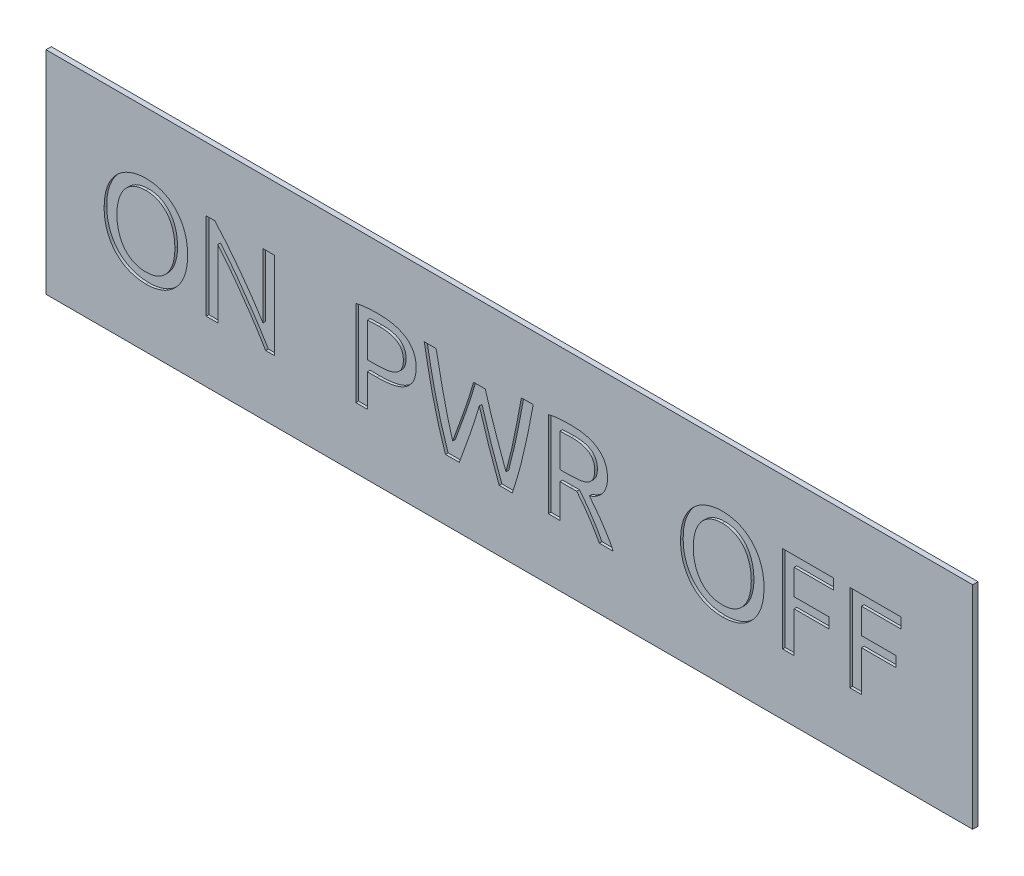
from build123d import *

# Parameters (mm, degrees)
SKETCH1_W           = 35
SKETCH1_H           = 8
BOSS_EXTRUDE1_DEPTH = 0.1
CUT_EXTRUDE6_DEPTH  = 0.1


with BuildPart() as part:
    # Sketch1 → Boss-Extrude1 (new, symmetric)
    with BuildSketch(Plane.XY):
        Rectangle(SKETCH1_W, SKETCH1_H)
    extrude(amount=BOSS_EXTRUDE1_DEPTH, both=True)

    # Sketch7 → Cut-Extrude6 (cut)
    # profile 1 of 8: a face of its own
    with BuildSketch(Plane.XY.offset(0.1)):
        with BuildLine():
            add(Edge.make_bspline(
                [(-15.304079424, -0.049022426), (-15.303711672, -0.01410778), (-15.302985198, 0.054864134), (-15.29643003, 0.156658327), (-15.287217749, 0.255347293), (-15.273406889, 0.350797572), (-15.255811776, 0.443118605), (-15.233718512, 0.53209643), (-15.208523544, 0.618094325), (-15.169588863, 0.727342223), (-15.112403668, 0.856063335), (-15.032348333, 0.999329375), (-14.940816758, 1.129143393), (-14.837914782, 1.245256657), (-14.724247477, 1.347395749), (-14.602258295, 1.437189266), (-14.470303031, 1.511892083), (-14.330663947, 1.573567585), (-14.183943903, 1.621037689), (-14.032471376, 1.656252472), (-13.876348377, 1.677212428), (-13.77088267, 1.679804671), (-13.717665979, 1.681112685)],
                knots=[0, 0, 0, 0, 0.792570647, 1.565678649, 2.315000585, 3.042323967, 3.754365743, 4.447760496, 5.122927003, 5.788006273, 7.079540449, 8.315548746, 9.508262372, 10.678590765, 11.830029448, 12.971618296, 14.110595966, 15.26540766, 16.431545614, 17.60623219, 18.792134379, 20, 20, 20, 20], degree=3))
            add(Edge.make_bspline(
                [(-13.717665979, 1.681112685), (-13.665131948, 1.679814278), (-13.561252407, 1.677246837), (-13.407627844, 1.656247239), (-13.258880962, 1.621043424), (-13.114699473, 1.573445498), (-12.977190484, 1.511687829), (-12.84678032, 1.437399735), (-12.72676556, 1.347106369), (-12.614393603, 1.245300238), (-12.513092566, 1.128671498), (-12.42131865, 0.999561111), (-12.342132263, 0.855996769), (-12.285510026, 0.727264243), (-12.246840269, 0.617971748), (-12.220561936, 0.532228818), (-12.198747207, 0.443099453), (-12.181070184, 0.35080288), (-12.167282058, 0.255345812), (-12.158063432, 0.15665874), (-12.15151001, 0.054864026), (-12.150783297, -0.014107817), (-12.150415424, -0.049022426)],
                knots=[0, 0, 0, 0, 1.200098081, 2.373045331, 3.535064534, 4.688987579, 5.837020001, 6.974362863, 8.110785483, 9.261997156, 10.43304313, 11.633514769, 12.875015323, 14.172847705, 14.842252987, 15.523309022, 16.221213965, 16.93788722, 17.669941481, 18.424137386, 19.202274073, 20, 20, 20, 20], degree=3))
            add(Edge.make_bspline(
                [(-12.150415424, -0.049022426), (-12.150783259, -0.083937046), (-12.151509897, -0.152908911), (-12.158063863, -0.254703464), (-12.167280515, -0.353391122), (-12.181075711, -0.44884609), (-12.198727263, -0.541150229), (-12.220685674, -0.630464535), (-12.246713725, -0.716510023), (-12.28542675, -0.825807155), (-12.342312855, -0.954188708), (-12.421299056, -1.097614082), (-12.513095467, -1.226717994), (-12.614400557, -1.343331195), (-12.726735631, -1.445203961), (-12.846983419, -1.535318533), (-12.976974287, -1.610572755), (-13.114743264, -1.672061573), (-13.258768783, -1.720006733), (-13.407736606, -1.754057995), (-13.561237602, -1.775353865), (-13.665126975, -1.777880012), (-13.717665979, -1.779157537)],
                knots=[0, 0, 0, 0, 0.797660173, 1.57573272, 2.329866459, 3.061860379, 3.778474561, 4.476321977, 5.162310661, 5.831660765, 7.124614354, 8.366012575, 9.566385262, 10.73733471, 11.888451492, 13.024780439, 14.164642593, 15.312580385, 16.466408316, 17.627150272, 18.800000839, 20, 20, 20, 20], degree=3))
            add(Edge.make_bspline(
                [(-13.717665979, -1.779157537), (-13.770887536, -1.777870322), (-13.876362887, -1.7753193), (-14.032364334, -1.754062329), (-14.184054472, -1.720002172), (-14.330620302, -1.672183055), (-14.470518474, -1.610779612), (-14.602055705, -1.535105274), (-14.724276941, -1.445493419), (-14.837908822, -1.343287957), (-14.940810342, -1.227188517), (-15.032381273, -1.09738751), (-15.112169427, -0.954233928), (-15.182127857, -0.798598417), (-15.236354892, -0.628908491), (-15.276149082, -0.446819992), (-15.299326783, -0.2519699), (-15.302464571, -0.117979924), (-15.304079424, -0.049022426)],
                knots=[0, 0, 0, 0, 0.966294476, 1.915018171, 2.853846361, 3.786758636, 4.710609883, 5.623854635, 6.537127584, 7.458280418, 8.39454505, 9.348717906, 10.33752657, 11.366969081, 12.442722914, 13.566707643, 14.747714126, 16, 16, 16, 16], degree=3))
        make_face()
        with BuildLine():
            add(Edge.make_bspline(
                [(-14.822269646, -0.049022426), (-14.821387208, -0.098562219), (-14.819659118, -0.195576732), (-14.805052594, -0.337418603), (-14.781197571, -0.472432256), (-14.747849135, -0.600176975), (-14.705671986, -0.720010176), (-14.654938118, -0.830617581), (-14.596541371, -0.932082478), (-14.530283044, -1.024260356), (-14.455066719, -1.106400134), (-14.371840851, -1.178257209), (-14.281637336, -1.241399906), (-14.183255778, -1.293487045), (-14.077601257, -1.334531561), (-13.96538423, -1.364107748), (-13.846857469, -1.381222183), (-13.765856413, -1.383689903), (-13.724509868, -1.384949537)],
                knots=[0, 0, 0, 0, 1.219915151, 2.388977954, 3.50768494, 4.593874435, 5.637052367, 6.63265979, 7.586765503, 8.516249197, 9.422985944, 10.323153062, 11.219383466, 12.129300506, 13.057951657, 14.005149726, 14.981739616, 16, 16, 16, 16], degree=3))
            add(Edge.make_bspline(
                [(-13.724509868, -1.384949537), (-13.683163178, -1.383695521), (-13.602387605, -1.381245655), (-13.484521851, -1.364185631), (-13.373435989, -1.334545719), (-13.26900933, -1.293319018), (-13.171456225, -1.241411673), (-13.081974667, -1.178223114), (-12.999333023, -1.106437115), (-12.924990147, -1.023819345), (-12.857824256, -0.932346613), (-12.799612306, -0.830575776), (-12.748806918, -0.720022169), (-12.706650263, -0.600173552), (-12.673295997, -0.472433219), (-12.649442615, -0.33741833), (-12.634835632, -0.195576805), (-12.633107606, -0.098562244), (-12.632225201, -0.049022426)],
                knots=[0, 0, 0, 0, 1.020887007, 1.994421647, 2.933173523, 3.853731272, 4.761024907, 5.65494637, 6.553188372, 7.458468617, 8.393664282, 9.35023113, 10.348406742, 11.394275573, 12.483266916, 13.604859629, 14.776938053, 16, 16, 16, 16], degree=3))
            add(Edge.make_bspline(
                [(-12.632225201, -0.049022426), (-12.633107579, 0.000517413), (-12.634835552, 0.097532015), (-12.649442916, 0.23937325), (-12.673294934, 0.374389174), (-12.706654045, 0.50212583), (-12.748793671, 0.621987372), (-12.799658479, 0.732495876), (-12.85757005, 0.834265368), (-12.925448285, 0.925176117), (-12.999090672, 1.008360735), (-13.081793277, 1.080235995), (-13.171681857, 1.142570119), (-13.26896405, 1.194693018), (-13.37356143, 1.235597338), (-13.484395785, 1.266375053), (-13.602405569, 1.283135718), (-13.68316926, 1.285628634), (-13.724509868, 1.286904685)],
                knots=[0, 0, 0, 0, 1.22322333, 2.395456409, 3.517197116, 4.606332151, 5.652338984, 6.650646306, 7.607339372, 8.538116746, 9.447696349, 10.346056874, 11.236877336, 12.144290688, 13.064969904, 14.00531519, 14.978978287, 16, 16, 16, 16], degree=3))
            add(Edge.make_bspline(
                [(-13.724509868, 1.286904685), (-13.765850491, 1.285623337), (-13.846839946, 1.283113078), (-13.965508564, 1.266296353), (-14.077476905, 1.235581944), (-14.183300903, 1.194861309), (-14.281412543, 1.142557052), (-14.372021402, 1.080271233), (-14.455309435, 1.008325619), (-14.529825389, 0.925617309), (-14.59679594, 0.834000034), (-14.654891978, 0.732537892), (-14.705685222, 0.621975318), (-14.747845356, 0.502129271), (-14.781198633, 0.374388207), (-14.805052293, 0.239373524), (-14.819659198, 0.097531941), (-14.821387235, 0.000517388), (-14.822269646, -0.049022426)],
                knots=[0, 0, 0, 0, 1.018396545, 1.995117023, 2.943890731, 3.87266606, 4.782704772, 5.675860912, 6.576148398, 7.487158225, 8.412220005, 9.3664533, 10.362193854, 11.405511279, 12.491846017, 13.610702595, 14.779921723, 16, 16, 16, 16], degree=3))
        make_face(mode=Mode.SUBTRACT)
    # profile 2 of 8: a face of its own
    with BuildSketch(Plane.XY.offset(0.1)):
        with BuildLine():
            add(Edge.make_bspline(
                [(-9.202752479, -1.691555759), (-9.220743134, -1.661423793), (-9.257887969, -1.59921111), (-9.315875484, -1.503506888), (-9.37848805, -1.403018369), (-9.467074747, -1.259314965), (-9.585525569, -1.072204335), (-9.737331345, -0.842731351), (-9.89647982, -0.606833356), (-10.062300449, -0.369424768), (-10.227653984, -0.132419499), (-10.395179641, 0.095493939), (-10.558652602, 0.313403785), (-10.69299547, 0.486123275), (-10.796647727, 0.616834885), (-10.87037647, 0.70779293), (-10.941439228, 0.792778027), (-10.988681112, 0.846699004), (-11.011592312, 0.872849407)],
                knots=[0, 0, 0, 0, 0.536211493, 1.107101878, 1.709725042, 2.345231406, 3.686461233, 5.09309405, 6.549041612, 8.034224013, 9.51768749, 10.964334184, 12.35580431, 13.679839341, 14.307497034, 14.904682337, 15.468796748, 16, 16, 16, 16], degree=3))
            Line((-11.011592312, 0.872849407), (-11.011592312, -1.691555759))
            Line((-11.011592312, -1.691555759), (-11.449601201, -1.691555759))
            Line((-11.449601201, -1.691555759), (-11.449601201, 1.593510907))
            Line((-11.449601201, 1.593510907), (-11.125200868, 1.593510907))
            add(Edge.make_bspline(
                [(-11.125200868, 1.593510907), (-11.087100471, 1.552656464), (-11.008643807, 1.468528644), (-10.892103474, 1.334603692), (-10.770875155, 1.191619703), (-10.603541844, 0.987320037), (-10.393167796, 0.720790938), (-10.145776598, 0.3931849), (-9.904923516, 0.065155955), (-9.714860147, -0.207201488), (-9.572253682, -0.417859607), (-9.474297607, -0.565492492), (-9.385085828, -0.704302235), (-9.329889958, -0.794679179), (-9.303357646, -0.838122815)],
                knots=[0, 0, 0, 0, 0.660992713, 1.361121843, 2.100454566, 2.87918829, 4.485890073, 6.118014054, 7.736739817, 9.301156274, 10.04763001, 10.746920765, 11.397652589, 12, 12, 12, 12], degree=3))
            Line((-9.303357646, -0.838122815), (-9.303357646, 1.593510907))
            Line((-9.303357646, 1.593510907), (-8.865348757, 1.593510907))
            Line((-8.865348757, 1.593510907), (-8.865348757, -1.691555759))
            Line((-8.865348757, -1.691555759), (-9.202752479, -1.691555759))
        make_face()
    # profile 3 of 8: a face of its own
    with BuildSketch(Plane.XY.offset(0.1)):
        with BuildLine():
            add(Edge.make_bspline(
                [(-4.939009701, 1.637311796), (-4.883777756, 1.636571673), (-4.776363227, 1.635132287), (-4.620051613, 1.62262498), (-4.473462536, 1.602506019), (-4.336872874, 1.573887867), (-4.210051733, 1.537264416), (-4.093488057, 1.491082182), (-3.9860392, 1.438078619), (-3.88892203, 1.376180022), (-3.802078455, 1.306449265), (-3.726669444, 1.22786657), (-3.663558262, 1.14075093), (-3.610468028, 1.046301817), (-3.571327457, 0.942706091), (-3.542628201, 0.831665047), (-3.524172384, 0.71263062), (-3.522500171, 0.630417784), (-3.521640312, 0.58814363)],
                knots=[0, 0, 0, 0, 1.323588682, 2.574101923, 3.755630084, 4.86767096, 5.916157507, 6.915250569, 7.868889214, 8.783499018, 9.669872833, 10.532261896, 11.385292325, 12.241907484, 13.121237873, 14.030997167, 14.987531205, 16, 16, 16, 16], degree=3))
            add(Edge.make_bspline(
                [(-3.521640312, 0.58814363), (-3.522678687, 0.542442188), (-3.524692643, 0.45380297), (-3.544266465, 0.326199959), (-3.575223202, 0.208481721), (-3.620154307, 0.101644653), (-3.67663083, 0.00462934), (-3.745284075, -0.082165432), (-3.824438992, -0.160415012), (-3.915725933, -0.228021735), (-4.016978787, -0.287102493), (-4.128726331, -0.337239062), (-4.250896582, -0.377717369), (-4.382694302, -0.410580979), (-4.52394306, -0.434588516), (-4.674022303, -0.452197171), (-4.832985124, -0.463483384), (-4.941955801, -0.464572209), (-4.997867146, -0.46513087)],
                knots=[0, 0, 0, 0, 1.059899074, 2.055703731, 2.98807339, 3.877898106, 4.736854624, 5.585189612, 6.438745172, 7.312277904, 8.213914796, 9.15461917, 10.149071902, 11.196829784, 12.303950324, 13.471508766, 14.702666166, 16, 16, 16, 16], degree=3))
            Line((-4.997867146, -0.46513087), (-5.361277646, -0.46513087))
            Line((-5.361277646, -0.46513087), (-5.361277646, -1.691555759))
            Line((-5.361277646, -1.691555759), (-5.799286535, -1.691555759))
            Line((-5.799286535, -1.691555759), (-5.799286535, 1.557238296))
            add(Edge.make_bspline(
                [(-5.799286535, 1.557238296), (-5.766506147, 1.564877879), (-5.699457616, 1.580503769), (-5.595000206, 1.59798093), (-5.48512998, 1.611441818), (-5.371415674, 1.621280677), (-5.257549366, 1.628855585), (-5.146852053, 1.633122813), (-5.041241694, 1.637258968), (-4.972548766, 1.637294465), (-4.939009701, 1.637311796)],
                knots=[0, 0, 0, 0, 0.932724882, 1.907781967, 2.933611764, 4.000103807, 5.07095428, 6.096238298, 7.070495492, 8, 8, 8, 8], degree=3))
        make_face()
        with BuildLine():
            add(Edge.make_bspline(
                [(-4.913687312, 1.243103796), (-4.959543029, 1.243044994), (-5.045560885, 1.242934691), (-5.166039575, 1.240276081), (-5.269420859, 1.235747734), (-5.332542326, 1.230926459), (-5.361277646, 1.22873163)],
                knots=[0, 0, 0, 0, 1.228375436, 2.304232294, 3.228021308, 4, 4, 4, 4], degree=3))
            Line((-5.361277646, 1.22873163), (-5.361277646, -0.07092287))
            Line((-5.361277646, -0.07092287), (-5.017030035, -0.07092287))
            add(Edge.make_bspline(
                [(-5.017030035, -0.07092287), (-4.978698514, -0.070484189), (-4.904048848, -0.069629867), (-4.795126762, -0.064299492), (-4.692131692, -0.054757951), (-4.594988331, -0.041299936), (-4.504211845, -0.02348104), (-4.420830439, 0.000843679), (-4.344471436, 0.029121533), (-4.27532391, 0.063600955), (-4.213041707, 0.103653979), (-4.159061903, 0.151813652), (-4.112030033, 0.206156183), (-4.072586153, 0.268095201), (-4.040433059, 0.337814357), (-4.019412161, 0.416981858), (-4.005104138, 0.504356539), (-4.004017034, 0.565721933), (-4.00345009, 0.597725074)],
                knots=[0, 0, 0, 0, 1.322266042, 2.575079697, 3.760616367, 4.889097047, 5.957073223, 6.948302351, 7.882241877, 8.76206493, 9.608928325, 10.428439932, 11.248706848, 12.080407261, 12.953766264, 13.885548308, 14.897275961, 16, 16, 16, 16], degree=3))
            add(Edge.make_bspline(
                [(-4.00345009, 0.597725074), (-4.004320995, 0.628354612), (-4.005987899, 0.686979265), (-4.019910921, 0.770645883), (-4.041986737, 0.846309683), (-4.074727482, 0.913327645), (-4.115276209, 0.972841877), (-4.16143631, 1.02649019), (-4.215352346, 1.072824868), (-4.274868251, 1.113183468), (-4.340332774, 1.147179414), (-4.410304076, 1.176164443), (-4.485579631, 1.198705039), (-4.593677441, 1.221020751), (-4.736947783, 1.239684953), (-4.853851017, 1.241946325), (-4.913687312, 1.243103796)],
                knots=[0, 0, 0, 0, 1.011973223, 1.936907372, 2.795807063, 3.608708974, 4.391018456, 5.171435309, 5.941211785, 6.73399345, 7.543635257, 8.375556202, 9.234455893, 10.136760064, 12.022621272, 14, 14, 14, 14], degree=3))
        make_face(mode=Mode.SUBTRACT)
    # profile 4 of 8: a face of its own
    with BuildSketch(Plane.XY.offset(0.1)):
        with BuildLine():
            add(Edge.make_bspline(
                [(-1.134491868, 0.532023741), (-1.165162065, 0.428344091), (-1.225488985, 0.224410804), (-1.320507338, -0.074374568), (-1.41444086, -0.362088358), (-1.541207931, -0.727307187), (-1.699435866, -1.169559417), (-1.828405445, -1.518965529), (-1.892110368, -1.691555759)],
                knots=[0, 0, 0, 0, 0.828263271, 1.629157224, 2.401772155, 3.146787536, 4.590646879, 6, 6, 6, 6], degree=3))
            Line((-1.892110368, -1.691555759), (-2.414983479, -1.691555759))
            add(Edge.make_bspline(
                [(-2.414983479, -1.691555759), (-2.456292791, -1.569275815), (-2.539712909, -1.322343415), (-2.65307735, -0.944063079), (-2.761082204, -0.5564017), (-2.859871631, -0.156664656), (-2.954903113, 0.256470321), (-3.044190498, 0.686452915), (-3.133622821, 1.133505515), (-3.187560191, 1.438272671), (-3.21503409, 1.593510907)],
                knots=[0, 0, 0, 0, 0.915130321, 1.848016259, 2.799708731, 3.768362692, 4.767418308, 5.805470963, 6.882180016, 8, 8, 8, 8], degree=3))
            Line((-3.21503409, 1.593510907), (-2.76539059, 1.593510907))
            add(Edge.make_bspline(
                [(-2.76539059, 1.593510907), (-2.741734842, 1.470308091), (-2.694356402, 1.223553814), (-2.6223382, 0.855229991), (-2.545254761, 0.492489883), (-2.4683777, 0.139015141), (-2.387622022, -0.200778109), (-2.321520327, -0.474898667), (-2.267414797, -0.685133162), (-2.226059104, -0.834881029), (-2.185464358, -0.979118601), (-2.156268804, -1.072703326), (-2.141912312, -1.118722259)],
                knots=[0, 0, 0, 0, 1.35174019, 2.70730559, 4.043653537, 5.347394012, 6.604832928, 7.806719203, 8.385614942, 8.943765689, 9.480612075, 10, 10, 10, 10], degree=3))
            add(Edge.make_bspline(
                [(-2.141912312, -1.118722259), (-2.110111938, -1.033891687), (-2.045123405, -0.860528493), (-1.947218506, -0.594081025), (-1.846722054, -0.315492009), (-1.743532835, -0.026027431), (-1.64066274, 0.272233179), (-1.539579902, 0.5764493), (-1.444166235, 0.886179335), (-1.382925892, 1.094524247), (-1.352127535, 1.199302907)],
                knots=[0, 0, 0, 0, 0.887621379, 1.813979004, 2.781198881, 3.789309646, 4.824846145, 5.872348018, 6.929983345, 8, 8, 8, 8], degree=3))
            Line((-1.352127535, 1.199302907), (-0.910012312, 1.199302907))
            add(Edge.make_bspline(
                [(-0.910012312, 1.199302907), (-0.880123545, 1.094456405), (-0.820639705, 0.885793651), (-0.723882149, 0.576906924), (-0.626140942, 0.271830713), (-0.522793658, -0.026143292), (-0.418516802, -0.315211386), (-0.319195891, -0.594140457), (-0.221489978, -0.860241825), (-0.15807394, -1.033849705), (-0.127071424, -1.118722259)],
                knots=[0, 0, 0, 0, 1.069075802, 2.127646578, 3.173989218, 4.210441619, 5.220195197, 6.187512888, 7.113920347, 8, 8, 8, 8], degree=3))
            add(Edge.make_bspline(
                [(-0.127071424, -1.118722259), (-0.114420383, -1.073352843), (-0.088585931, -0.980704805), (-0.050967951, -0.838106112), (-0.013419536, -0.689105601), (0.037251133, -0.479333174), (0.100710963, -0.205826857), (0.174321608, 0.134640031), (0.246517577, 0.488790223), (0.317028359, 0.853253505), (0.386635128, 1.222555859), (0.431108156, 1.470060748), (0.453290354, 1.593510907)],
                knots=[0, 0, 0, 0, 0.509253081, 1.039936201, 1.59450146, 2.170617112, 3.373252013, 4.630166093, 5.93675175, 7.281077675, 8.643859539, 10, 10, 10, 10], degree=3))
            Line((0.453290354, 1.593510907), (0.902249465, 1.593510907))
            add(Edge.make_bspline(
                [(0.902249465, 1.593510907), (0.874173038, 1.43830013), (0.819066806, 1.133664464), (0.730406178, 0.686328932), (0.639683641, 0.25665189), (0.545681435, -0.15659087), (0.448175917, -0.556289022), (0.342254831, -0.943946444), (0.231588379, -1.322186561), (0.15053394, -1.569255297), (0.110411521, -1.691555759)],
                knots=[0, 0, 0, 0, 1.119222041, 2.196722142, 3.235871632, 4.235300787, 5.203887546, 6.154994787, 7.086711679, 8, 8, 8, 8], degree=3))
            Line((0.110411521, -1.691555759), (-0.383032868, -1.691555759))
            add(Edge.make_bspline(
                [(-0.383032868, -1.691555759), (-0.447633855, -1.519045554), (-0.578251961, -1.170243512), (-0.735197194, -0.727798191), (-0.857498695, -0.361769111), (-0.950903776, -0.074556158), (-1.042955366, 0.224792823), (-1.103620236, 0.428406938), (-1.134491868, 0.532023741)],
                knots=[0, 0, 0, 0, 1.4123076, 2.855574677, 3.598939349, 4.371092825, 5.171068497, 6, 6, 6, 6], degree=3))
        make_face()
    # profile 5 of 8: a face of its own
    with BuildSketch(Plane.XY.offset(0.1)):
        with BuildLine():
            add(Edge.make_bspline(
                [(3.02453941, -0.331675037), (3.038211028, -0.348569425), (3.067392015, -0.384629159), (3.114408698, -0.44201287), (3.165111912, -0.507936223), (3.242834229, -0.606217081), (3.344918435, -0.741700188), (3.467366251, -0.918000811), (3.591719691, -1.106279202), (3.713749935, -1.300840459), (3.82823892, -1.495019397), (3.893128788, -1.627490259), (3.924510799, -1.691555759)],
                knots=[0, 0, 0, 0, 0.39895293, 0.851533429, 1.361692953, 1.925477831, 3.151634299, 4.474851238, 5.865126127, 7.293134198, 8.690906733, 10, 10, 10, 10], degree=3))
            Line((3.924510799, -1.691555759), (3.398900132, -1.691555759))
            add(Edge.make_bspline(
                [(3.398900132, -1.691555759), (3.36644761, -1.63156077), (3.300615245, -1.509856451), (3.193933588, -1.330525233), (3.084895254, -1.15285985), (2.972633077, -0.982886565), (2.860704862, -0.822140824), (2.766919149, -0.695635621), (2.693697475, -0.600911895), (2.643318606, -0.534459293), (2.593910411, -0.474189111), (2.562114522, -0.435250186), (2.546835965, -0.416539259)],
                knots=[0, 0, 0, 0, 1.332032401, 2.702127276, 4.074589059, 5.403017504, 6.679814136, 7.899745713, 8.478100808, 9.01815218, 9.52820262, 10, 10, 10, 10], degree=3))
            add(Edge.make_bspline(
                [(2.546835965, -0.416539259), (2.526995684, -0.417831708), (2.48711496, -0.420429644), (2.426615233, -0.421576963), (2.365017065, -0.421266049), (2.323497197, -0.421308515), (2.302509132, -0.421329981)],
                knots=[0, 0, 0, 0, 0.975943851, 1.961733701, 2.969667585, 4, 4, 4, 4], degree=3))
            Line((2.302509132, -0.421329981), (1.90966991, -0.421329981))
            Line((1.90966991, -0.421329981), (1.90966991, -1.691555759))
            Line((1.90966991, -1.691555759), (1.471661021, -1.691555759))
            Line((1.471661021, -1.691555759), (1.471661021, 1.557238296))
            add(Edge.make_bspline(
                [(1.471661021, 1.557238296), (1.50421438, 1.564868899), (1.570587356, 1.58042692), (1.673886265, 1.597998093), (1.782393662, 1.611440464), (1.894739727, 1.621282242), (2.007238053, 1.628851366), (2.116794626, 1.633138192), (2.221265057, 1.637249068), (2.289273646, 1.637291268), (2.32235641, 1.637311796)],
                knots=[0, 0, 0, 0, 0.936858455, 1.910158761, 2.934709766, 4.000327786, 5.07032876, 6.094241242, 7.072944044, 8, 8, 8, 8], degree=3))
            add(Edge.make_bspline(
                [(2.32235641, 1.637311796), (2.376902707, 1.636565242), (2.482947958, 1.635113842), (2.637007212, 1.622724583), (2.781252525, 1.60232334), (2.915601135, 1.574334074), (3.039375232, 1.536086752), (3.153816191, 1.491673771), (3.257502988, 1.436955028), (3.351962119, 1.375739691), (3.435750546, 1.305471781), (3.507830946, 1.226236361), (3.569413321, 1.139236994), (3.619864819, 1.044109348), (3.657718512, 0.940508295), (3.686248504, 0.829428311), (3.702486722, 0.709988791), (3.70448225, 0.627658146), (3.705506354, 0.585406074)],
                knots=[0, 0, 0, 0, 1.323601272, 2.573256743, 3.747691024, 4.857446838, 5.899470048, 6.888477296, 7.831963868, 8.739467171, 9.61562628, 10.477767351, 11.331817884, 12.196142649, 13.082579076, 14.002377664, 14.974820596, 16, 16, 16, 16], degree=3))
            add(Edge.make_bspline(
                [(3.705506354, 0.585406074), (3.705027565, 0.558232448), (3.704087829, 0.504897895), (3.695292296, 0.42653474), (3.682921256, 0.350830761), (3.663288669, 0.278497092), (3.639686785, 0.208589132), (3.609049418, 0.142348739), (3.574423601, 0.07839541), (3.53382632, 0.017933762), (3.487722383, -0.038790368), (3.43715364, -0.092622703), (3.380536978, -0.141705773), (3.319700139, -0.18779151), (3.253395515, -0.229611162), (3.182175978, -0.26806513), (3.105365399, -0.302170293), (3.051807925, -0.32172093), (3.02453941, -0.331675037)],
                knots=[0, 0, 0, 0, 1.060243578, 2.080974247, 3.074982359, 4.051242852, 5.003075487, 5.951528304, 6.896001729, 7.839425154, 8.789256386, 9.746654126, 10.718355673, 11.710327577, 12.723142916, 13.7749394, 14.867121724, 16, 16, 16, 16], degree=3))
        make_face()
        with BuildLine():
            add(Edge.make_bspline(
                [(2.349047576, 1.243103796), (2.304104399, 1.243043278), (2.219683315, 1.242929599), (2.101484824, 1.240285853), (1.999929257, 1.235732889), (1.937948882, 1.23092518), (1.90966991, 1.22873163)],
                knots=[0, 0, 0, 0, 1.226397817, 2.303660725, 3.226033522, 4, 4, 4, 4], degree=3))
            Line((1.90966991, 1.22873163), (1.90966991, -0.027121981))
            Line((1.90966991, -0.027121981), (2.228595132, -0.027121981))
            add(Edge.make_bspline(
                [(2.228595132, -0.027121981), (2.266242657, -0.026935462), (2.339745327, -0.026571302), (2.447004846, -0.021533853), (2.548351871, -0.01413387), (2.643621421, -0.004097868), (2.732646315, 0.009350901), (2.814404087, 0.030344453), (2.889313059, 0.055214616), (2.957424532, 0.085978683), (3.017860242, 0.123806779), (3.071741433, 0.167846274), (3.11679314, 0.22000197), (3.156218614, 0.278334569), (3.187417071, 0.345850458), (3.20874043, 0.423255609), (3.221805566, 0.510135401), (3.223046597, 0.571211907), (3.223696576, 0.603200185)],
                knots=[0, 0, 0, 0, 1.331103828, 2.598834446, 3.795999538, 4.923781214, 5.986046906, 6.976019087, 7.904566374, 8.774462249, 9.611574649, 10.419252693, 11.225156327, 12.039533879, 12.902105529, 13.841729319, 14.869624859, 16, 16, 16, 16], degree=3))
            add(Edge.make_bspline(
                [(3.223696576, 0.603200185), (3.223032146, 0.63313912), (3.221752141, 0.69081559), (3.208528119, 0.773556405), (3.187156276, 0.848876876), (3.155596399, 0.915876452), (3.117858783, 0.975876689), (3.073720897, 1.029081007), (3.023359476, 1.075456556), (2.966467367, 1.114402515), (2.904695938, 1.147939188), (2.837771453, 1.176139779), (2.765567446, 1.198745475), (2.660874919, 1.221069428), (2.52147217, 1.239713525), (2.407517501, 1.241954141), (2.349047576, 1.243103796)],
                knots=[0, 0, 0, 0, 1.015413047, 1.956163169, 2.835783782, 3.663755472, 4.460733554, 5.23601356, 6.003247679, 6.77651437, 7.569986583, 8.385408099, 9.237644693, 10.133775775, 12.016247684, 14, 14, 14, 14], degree=3))
        make_face(mode=Mode.SUBTRACT)
    # profile 6 of 8: a face of its own
    with BuildSketch(Plane.XY.offset(0.1)):
        with BuildLine():
            add(Edge.make_bspline(
                [(6.464962354, -0.049022426), (6.465330106, -0.01410778), (6.466056579, 0.054864134), (6.472611748, 0.156658327), (6.481824028, 0.255347293), (6.495634888, 0.350797572), (6.513230002, 0.443118605), (6.535323266, 0.53209643), (6.560518233, 0.618094325), (6.599452915, 0.727342223), (6.65663811, 0.856063335), (6.736693444, 0.999329375), (6.82822502, 1.129143393), (6.931126996, 1.245256657), (7.044794301, 1.347395749), (7.166783483, 1.437189266), (7.298738747, 1.511892083), (7.438377831, 1.573567585), (7.585097875, 1.621037689), (7.736570402, 1.656252472), (7.892693401, 1.677212428), (7.998159108, 1.679804671), (8.051375799, 1.681112685)],
                knots=[0, 0, 0, 0, 0.792570647, 1.565678649, 2.315000585, 3.042323967, 3.754365743, 4.447760496, 5.122927003, 5.788006273, 7.079540449, 8.315548746, 9.508262372, 10.678590765, 11.830029448, 12.971618296, 14.110595966, 15.26540766, 16.431545614, 17.60623219, 18.792134379, 20, 20, 20, 20], degree=3))
            add(Edge.make_bspline(
                [(8.051375799, 1.681112685), (8.10390983, 1.679814278), (8.207789371, 1.677246837), (8.361413934, 1.656247239), (8.510160816, 1.621043424), (8.654342304, 1.573445498), (8.791851294, 1.511687829), (8.922261457, 1.437399735), (9.042276218, 1.347106369), (9.154648175, 1.245300238), (9.255949212, 1.128671498), (9.347723128, 0.999561111), (9.426909514, 0.855996769), (9.483531752, 0.727264243), (9.522201509, 0.617971748), (9.548479842, 0.532228818), (9.570294571, 0.443099453), (9.587971593, 0.35080288), (9.60175972, 0.255345812), (9.610978346, 0.15665874), (9.617531768, 0.054864026), (9.618258481, -0.014107817), (9.618626354, -0.049022426)],
                knots=[0, 0, 0, 0, 1.200098081, 2.373045331, 3.535064534, 4.688987579, 5.837020001, 6.974362863, 8.110785483, 9.261997156, 10.43304313, 11.633514769, 12.875015323, 14.172847705, 14.842252987, 15.523309022, 16.221213965, 16.93788722, 17.669941481, 18.424137386, 19.202274073, 20, 20, 20, 20], degree=3))
            add(Edge.make_bspline(
                [(9.618626354, -0.049022426), (9.618258519, -0.083937046), (9.61753188, -0.152908911), (9.610977915, -0.254703464), (9.601761263, -0.353391122), (9.587966067, -0.44884609), (9.570314515, -0.541150229), (9.548356103, -0.630464535), (9.522328053, -0.716510023), (9.483615028, -0.825807155), (9.426728923, -0.954188708), (9.347742722, -1.097614082), (9.25594631, -1.226717994), (9.154641221, -1.343331195), (9.042306147, -1.445203961), (8.922058359, -1.535318533), (8.792067491, -1.610572755), (8.654298514, -1.672061573), (8.510272995, -1.720006733), (8.361305172, -1.754057995), (8.207804176, -1.775353865), (8.103914803, -1.777880012), (8.051375799, -1.779157537)],
                knots=[0, 0, 0, 0, 0.797660173, 1.57573272, 2.329866459, 3.061860379, 3.778474561, 4.476321977, 5.162310661, 5.831660765, 7.124614354, 8.366012575, 9.566385262, 10.73733471, 11.888451492, 13.024780439, 14.164642593, 15.312580385, 16.466408316, 17.627150272, 18.800000839, 20, 20, 20, 20], degree=3))
            add(Edge.make_bspline(
                [(8.051375799, -1.779157537), (7.998154242, -1.777870322), (7.892678891, -1.7753193), (7.736677444, -1.754062329), (7.584987306, -1.720002172), (7.438421475, -1.672183055), (7.298523304, -1.610779612), (7.166986072, -1.535105274), (7.044764837, -1.445493419), (6.931132956, -1.343287957), (6.828231436, -1.227188517), (6.736660505, -1.09738751), (6.656872351, -0.954233928), (6.586913921, -0.798598417), (6.532686885, -0.628908491), (6.492892696, -0.446819992), (6.469714995, -0.2519699), (6.466577207, -0.117979924), (6.464962354, -0.049022426)],
                knots=[0, 0, 0, 0, 0.966294476, 1.915018171, 2.853846361, 3.786758636, 4.710609883, 5.623854635, 6.537127584, 7.458280418, 8.39454505, 9.348717906, 10.33752657, 11.366969081, 12.442722914, 13.566707643, 14.747714126, 16, 16, 16, 16], degree=3))
        make_face()
        with BuildLine():
            add(Edge.make_bspline(
                [(6.946772132, -0.049022426), (6.947654569, -0.098562219), (6.94938266, -0.195576732), (6.963989184, -0.337418603), (6.987844207, -0.472432256), (7.021192643, -0.600176975), (7.063369792, -0.720010176), (7.11410366, -0.830617581), (7.172500407, -0.932082478), (7.238758733, -1.024260356), (7.313975059, -1.106400134), (7.397200926, -1.178257209), (7.487404442, -1.241399906), (7.585786, -1.293487045), (7.691440521, -1.334531561), (7.803657547, -1.364107748), (7.922184309, -1.381222183), (8.003185365, -1.383689903), (8.04453191, -1.384949537)],
                knots=[0, 0, 0, 0, 1.219915151, 2.388977954, 3.50768494, 4.593874435, 5.637052367, 6.63265979, 7.586765503, 8.516249197, 9.422985944, 10.323153062, 11.219383466, 12.129300506, 13.057951657, 14.005149726, 14.981739616, 16, 16, 16, 16], degree=3))
            add(Edge.make_bspline(
                [(8.04453191, -1.384949537), (8.0858786, -1.383695521), (8.166654173, -1.381245655), (8.284519927, -1.364185631), (8.395605789, -1.334545719), (8.500032448, -1.293319018), (8.597585553, -1.241411673), (8.687067111, -1.178223114), (8.769708755, -1.106437115), (8.844051631, -1.023819345), (8.911217522, -0.932346613), (8.969429472, -0.830575776), (9.02023486, -0.720022169), (9.062391514, -0.600173552), (9.095745781, -0.472433219), (9.119599163, -0.33741833), (9.134206146, -0.195576805), (9.135934172, -0.098562244), (9.136816576, -0.049022426)],
                knots=[0, 0, 0, 0, 1.020887007, 1.994421647, 2.933173523, 3.853731272, 4.761024907, 5.65494637, 6.553188372, 7.458468617, 8.393664282, 9.35023113, 10.348406742, 11.394275573, 12.483266916, 13.604859629, 14.776938053, 16, 16, 16, 16], degree=3))
            add(Edge.make_bspline(
                [(9.136816576, -0.049022426), (9.135934199, 0.000517413), (9.134206226, 0.097532015), (9.119598862, 0.23937325), (9.095746843, 0.374389174), (9.062387733, 0.50212583), (9.020248106, 0.621987372), (8.969383298, 0.732495876), (8.911471728, 0.834265368), (8.843593493, 0.925176117), (8.769951106, 1.008360735), (8.687248501, 1.080235995), (8.597359921, 1.142570119), (8.500077728, 1.194693018), (8.395480347, 1.235597338), (8.284645992, 1.266375053), (8.166636209, 1.283135718), (8.085872518, 1.285628634), (8.04453191, 1.286904685)],
                knots=[0, 0, 0, 0, 1.22322333, 2.395456409, 3.517197116, 4.606332151, 5.652338984, 6.650646306, 7.607339372, 8.538116746, 9.447696349, 10.346056874, 11.236877336, 12.144290688, 13.064969904, 14.00531519, 14.978978287, 16, 16, 16, 16], degree=3))
            add(Edge.make_bspline(
                [(8.04453191, 1.286904685), (8.003191287, 1.285623337), (7.922201832, 1.283113078), (7.803533214, 1.266296353), (7.691564872, 1.235581944), (7.585740875, 1.194861309), (7.487629235, 1.142557052), (7.397020375, 1.080271233), (7.313732343, 1.008325619), (7.239216389, 0.925617309), (7.172245838, 0.834000034), (7.114149799, 0.732537892), (7.063356556, 0.621975318), (7.021196421, 0.502129271), (6.987843145, 0.374388207), (6.963989484, 0.239373524), (6.949382579, 0.097531941), (6.947654542, 0.000517388), (6.946772132, -0.049022426)],
                knots=[0, 0, 0, 0, 1.018396545, 1.995117023, 2.943890731, 3.87266606, 4.782704772, 5.675860912, 6.576148398, 7.487158225, 8.412220005, 9.3664533, 10.362193854, 11.405511279, 12.491846017, 13.610702595, 14.779921723, 16, 16, 16, 16], degree=3))
        make_face(mode=Mode.SUBTRACT)
    # profile 7 of 8: a face of its own
    with BuildSketch(Plane.XY.offset(0.1)):
        Polygon((10.319440576, -1.691555759), (10.319440576, 1.593510907), (12.246679688, 1.593510907), (12.246679688, 1.199302907), (10.757449465, 1.199302907), (10.757449465, 0.235683352), (12.071476132, 0.235683352), (12.071476132, -0.158524648), (10.757449465, -0.158524648), (10.757449465, -1.691555759), align=None)
    # profile 8 of 8: a face of its own
    with BuildSketch(Plane.XY.offset(0.1)):
        Polygon((12.859892132, -1.691555759), (12.859892132, 1.593510907), (14.787131243, 1.593510907), (14.787131243, 1.199302907), (13.297901021, 1.199302907), (13.297901021, 0.235683352), (14.611927688, 0.235683352), (14.611927688, -0.158524648), (13.297901021, -0.158524648), (13.297901021, -1.691555759), align=None)
    extrude(amount=-CUT_EXTRUDE6_DEPTH, mode=Mode.SUBTRACT)


solid = part.part
